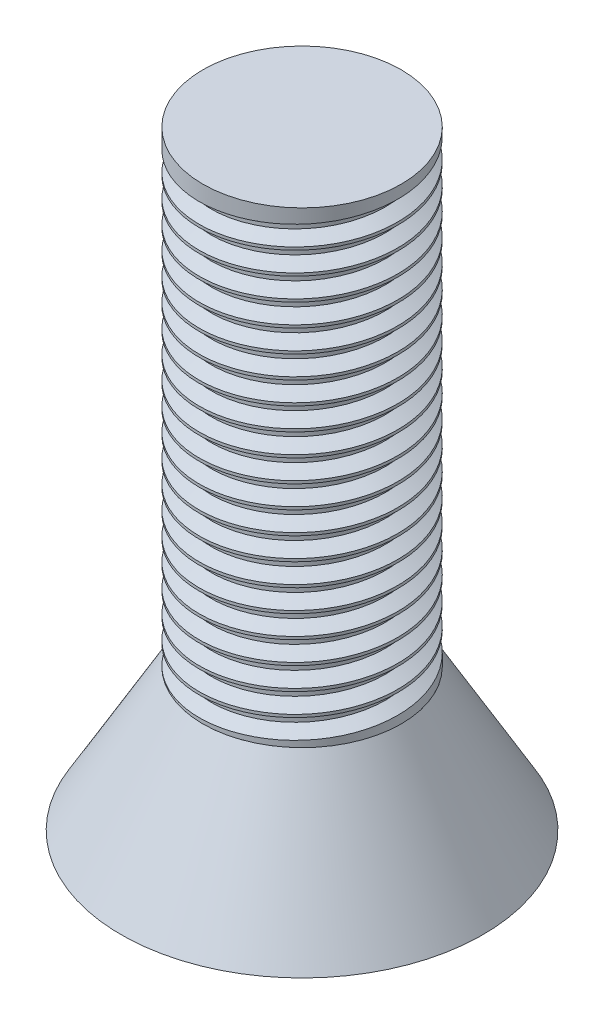
from build123d import *

# Parameters (mm, degrees)
CROQUIS1_R              = 1.4
SALIENTE_EXTRUIR1_DEPTH = 3.6
CROQUIS5_R              = 1.4
SALIENTE_EXTRUIR3_DEPTH = 2
SALIENTE_EXTRUIR3_DRAFT = -30
CORTAR_EXTRUIR1_DEPTH   = 0.25
CROQUIS7_R              = 1.4
SALIENTE_EXTRUIR4_DEPTH = 3
ROSCA1_PITCH            = 0.3175


with BuildPart() as part:
    # Croquis1 → Saliente-Extruir1 (new body)
    with BuildSketch(Plane(origin=(0, 0, 0), x_dir=(1, 0, 0), z_dir=(0, 1, 0))):
        with Locations(Location((0, 0, 0), (0, 0, 270))):
            Circle(CROQUIS1_R)
    extrude(amount=SALIENTE_EXTRUIR1_DEPTH)

    # Croquis7 → Saliente-Extruir4 (add)
    with BuildSketch(Plane(origin=(0, 3.6, 0), x_dir=(1, 0, 0), z_dir=(0, 1, 0))):
        with Locations(Location((0, 0, 0), (0, 0, 270))):
            Circle(CROQUIS7_R)
    extrude(amount=SALIENTE_EXTRUIR4_DEPTH)

    # Rosca1: the profile of Perfil de rosca2 profile screwed along a right-hand helix of 20 turns, 6 arcs to a turn; built about Z, then put on its axis
    rosca1_z = Axis((0, 0, 0), (0, 0, 1))
    rosca1_corners = [(1.4003, 0, -0.000173), (1.4003, 0, 0.277986), (1.228148, 0, 0.178594), (1.228148, 0, 0.099219)]
    with BuildLine(mode=Mode.PRIVATE) as rosca1_profile:
        Line(rosca1_corners[0], rosca1_corners[1])
        Line(rosca1_corners[1], rosca1_corners[2])
        Line(rosca1_corners[2], rosca1_corners[3])
        Line(rosca1_corners[3], rosca1_corners[0])
    rosca1_cap = Face(rosca1_profile.wire())
    rosca1_turn_angles = [0, 30, 60, 90, 120, 150, 180, 210, 240, 270, 300, 330, 360]
    rosca1_turn_weights = [1, 0.8660254037844387, 1, 0.8660254037844387, 1, 0.8660254037844387, 1, 0.8660254037844387, 1, 0.8660254037844387, 1, 0.8660254037844387, 1]
    rosca1_turn_rails = [Edge.make_bspline([Vector(p[0], p[1], 0).rotate(rosca1_z, rosca1_turn_angles[k]) / rosca1_turn_weights[k] + Vector(0, 0, p[2] + ROSCA1_PITCH * rosca1_turn_angles[k] / 360) for k in range(13)], [0, 0, 0, 1, 1, 2, 2, 3, 3, 4, 4, 5, 5, 6, 6, 6], 2, rosca1_turn_weights) for p in rosca1_corners]
    rosca1_turn_sides = [Face.make_surface_from_curves(rosca1_turn_rails[p[0]], rosca1_turn_rails[p[1]]) for p in [(0, 1), (1, 2), (2, 3), (3, 0)]]
    rosca1 = Plane(origin=(0, 6.6, 0), x_dir=(-1, 0, 0), z_dir=(0, -1, 0)) * Solid(Shell([*[p.moved(Location((0, 0, ROSCA1_PITCH * i))) for i in range(20) for p in rosca1_turn_sides], rosca1_cap, rosca1_cap.rotate(rosca1_z, 7200).moved(Location((0, 0, ROSCA1_PITCH * 7200 / 360)))]))
    add(rosca1, mode=Mode.SUBTRACT)


with BuildPart() as body_2:
    # Croquis5 → Saliente-Extruir3 (with draft: the straight prism first)
    with BuildSketch(Plane.XZ):
        with Locations(Location((0, 0, 0), (0, 0, 90))):
            Circle(CROQUIS5_R)
    extrude(amount=SALIENTE_EXTRUIR3_DEPTH)
    # Saliente-Extruir3: the draft: its side faces are tilted about the plane it starts from
    saliente_extruir3_sides = [body_2.faces().sort_by_distance(p)[0] for p in [
        (0, -1, -1.4),
    ]]
    draft(saliente_extruir3_sides, Plane.XZ, SALIENTE_EXTRUIR3_DRAFT)

    # Croquis6 → Cortar-Extruir1 (cut)
    with BuildSketch(Plane.XZ.offset(2)):
        with BuildLine():
            Line((-1.35382, 0.35382), (-2.238298, 0.35382))
            Line((-2.238298, 0.35382), (-2.238298, -0.35382))
            Line((-2.238298, -0.35382), (-1.35382, -0.35382))
            ThreePointArc((-1.35382, -0.35382), (-0.646713, -0.646713), (-0.35382, -1.35382))
            Line((-0.35382, -1.35382), (-0.35382, -2.238298))
            Line((-0.35382, -2.238298), (0.35382, -2.238298))
            Line((0.35382, -2.238298), (0.35382, -1.35382))
            ThreePointArc((0.35382, -1.35382), (0.646713, -0.646713), (1.35382, -0.35382))
            Line((1.35382, -0.35382), (2.238298, -0.35382))
            Line((2.238298, -0.35382), (2.238298, 0.35382))
            Line((2.238298, 0.35382), (1.35382, 0.35382))
            ThreePointArc((1.35382, 0.35382), (0.646713, 0.646713), (0.35382, 1.35382))
            Line((0.35382, 1.35382), (0.35382, 2.238298))
            Line((0.35382, 2.238298), (-0.35382, 2.238298))
            Line((-0.35382, 2.238298), (-0.35382, 1.35382))
            ThreePointArc((-0.35382, 1.35382), (-0.646713, 0.646713), (-1.35382, 0.35382))
        make_face()
    extrude(amount=-CORTAR_EXTRUIR1_DEPTH, mode=Mode.SUBTRACT)


solid = Compound([part.part, body_2.part])
